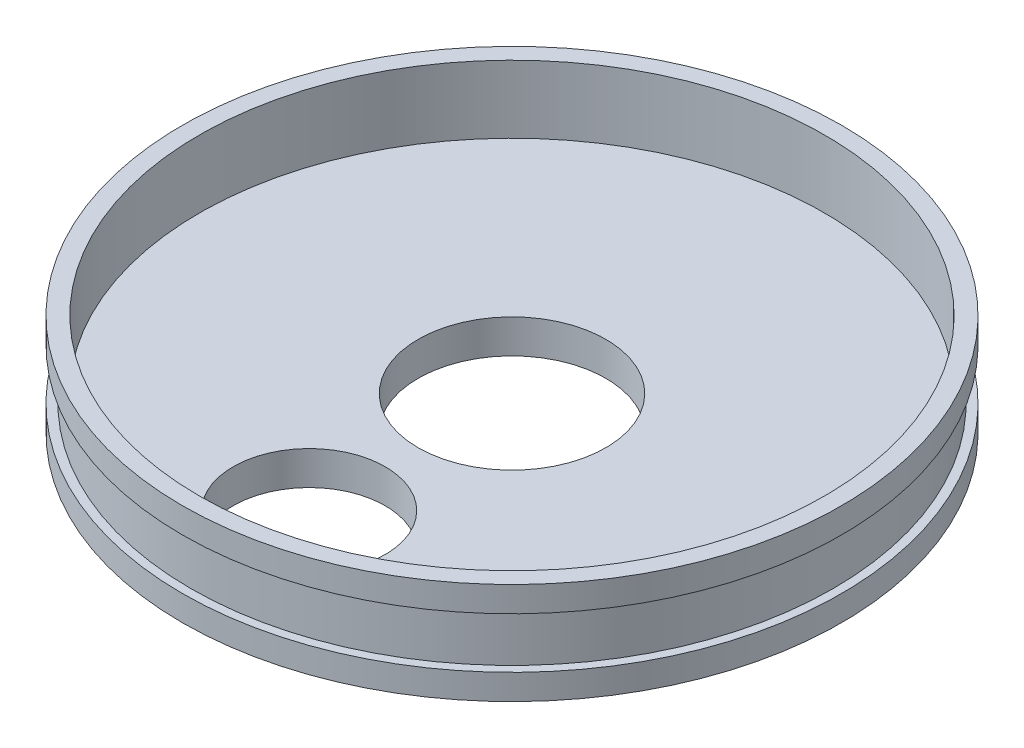
from build123d import *

# Parameters (mm, degrees)
SKETCH2_R      = 19.5
SKETCH2_R_2    = 4.5
SKETCH2_R_3    = 5.55625
LIDBASE_DEPTH  = 2
SKETCH2_4_R    = 19.5
SKETCH2_4_R_2  = 18.5
LIDWALLS_DEPTH = 6
SKETCH3_W      = 0.5
SKETCH3_H      = 3


with BuildPart() as part:
    # Sketch2 → LidBase (new body)
    with BuildSketch(Plane(origin=(0, 0, 0), x_dir=(1, 0, 0), z_dir=(0, 1, 0))):
        Circle(SKETCH2_R)
        with Locations((0, -12)):
            Circle(SKETCH2_R_2, mode=Mode.SUBTRACT)
        Circle(SKETCH2_R_3, mode=Mode.SUBTRACT)
    extrude(amount=LIDBASE_DEPTH)

    # Sketch2<4> → LidWalls (add)
    with BuildSketch(Plane(origin=(0, 0, 0), x_dir=(1, 0, 0), z_dir=(0, 1, 0))):
        Circle(SKETCH2_4_R)
        Circle(SKETCH2_4_R_2, mode=Mode.SUBTRACT)
    extrude(amount=LIDWALLS_DEPTH)

    # Sketch3 → Beltgrooves (revolve, cut)
    with BuildSketch(Plane(origin=(0, 0, 0), x_dir=(0, 0, -1), z_dir=(1, 0, 0))):
        with Locations((19.25, 3)):
            Rectangle(SKETCH3_W, SKETCH3_H)
    revolve(axis=Axis((0, 0, 0), (0, 1, 0)), mode=Mode.SUBTRACT)


solid = part.part
